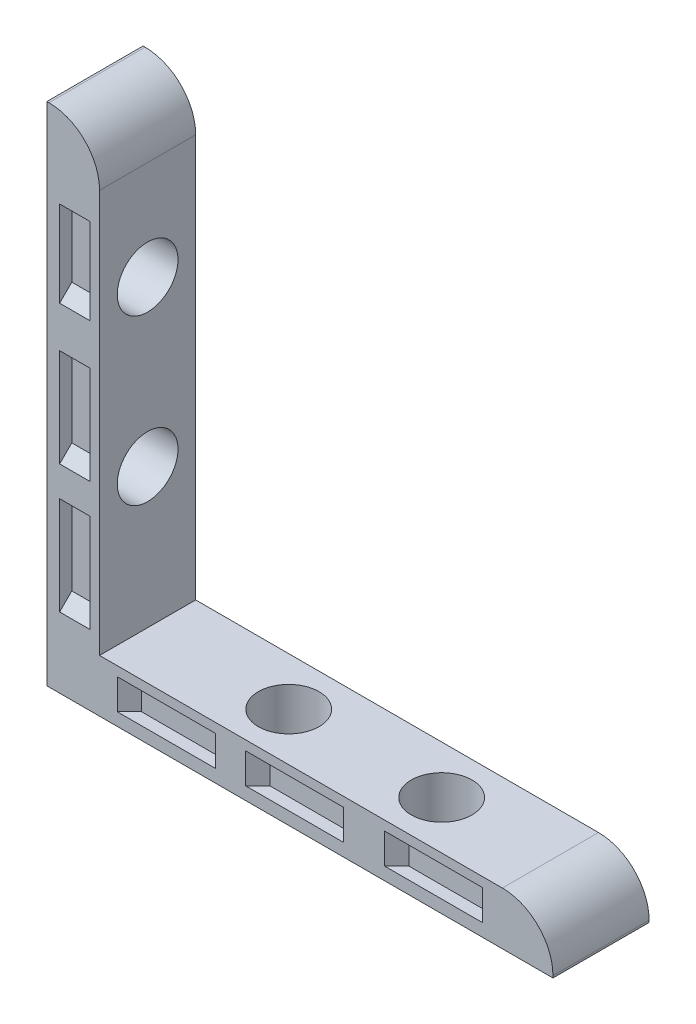
from build123d import *

# Parameters (mm, degrees)
EXTRUDE_1_DEPTH      = 9.5
SKETCH_2_R           = 3
CUT_EXTRUDE_1_DEPTH  = 66.909407523
SKETCH_4_R           = 3
CUT_EXTRUDE_2_DEPTH  = 53.175568995
FILLET_1_R           = 5
SKETCH_5_W           = 3
SKETCH_5_H           = 7.292258694
SKETCH_5_H_2         = 7.292258695
SKETCH_5_W_2         = 7.292258695
SKETCH_5_H_3         = 3
SKETCH_5_W_3         = 7.292258694
CUT_EXTRUDE_3_DEPTH  = 1.2
CHAMFER_1_SIZE       = 1.2
CHAMFER_2_SIZE       = 1.2
MIRROR_START         = -23.741274046
MIRROR_1_OUTLINE_W   = 7.292258694
MIRROR_1_OUTLINE_H   = 1.2
MIRROR_1_OUTLINE_W_2 = 7.292258695
MIRROR_1_DEPTH       = 3
MIRROR_START_2       = -16.84868645
MIRROR_1_2_OUTLINE_W = 3
MIRROR_1_2_OUTLINE_H = 1.2
MIRROR_1_2_DEPTH     = 7.292258695
MIRROR_START_3       = -4.181235969
MIRROR_1_3_OUTLINE_W = 3
MIRROR_1_3_OUTLINE_H = 1.2
MIRROR_1_3_DEPTH     = 7.292258694
MIRROR_START_4       = 9.571089537
MIRROR_1_4_OUTLINE_W = 3
MIRROR_1_4_OUTLINE_H = 1.2
MIRROR_1_4_DEPTH     = 7.292258694


# Read off the part's stored shape, not the designer's step: 镜向1
with BuildPart() as part:
    # 草图1 → 凸台-拉伸1 (new body)
    with BuildSketch(Plane.XY):
        Polygon((-19.8, 2.6), (-19.8, 47.4), (-25, 47.4), (-25, -2.6), (25, -2.6), (25, 2.6), align=None)
    extrude(amount=EXTRUDE_1_DEPTH)

    # 草图2 → 切除-拉伸1 (cut, through all)
    with BuildSketch(Plane(origin=(-19.8, 0, 0), x_dir=(0, 0, -1), z_dir=(1, 0, 0))):
        with Locations((-4.75, 32.604835918)):
            Circle(SKETCH_2_R)
        with Locations((-4.75, 16.388429447)):
            Circle(SKETCH_2_R)
    extrude(amount=-CUT_EXTRUDE_1_DEPTH, mode=Mode.SUBTRACT)

    # 草图4 → 切除-拉伸2 (cut, through all)
    with BuildSketch(Plane(origin=(0, 2.6, 0), x_dir=(1, 0, 0), z_dir=(0, 1, 0))):
        with Locations(Location((9.252806551, -4.75, 0), (0, 0, 270))):
            Circle(SKETCH_4_R)
        with Locations(Location((-5.859043595, -4.75, 0), (0, 0, 270))):
            Circle(SKETCH_4_R)
    extrude(amount=-CUT_EXTRUDE_2_DEPTH, mode=Mode.SUBTRACT)

    # 圆角1
    fillet_1_edges = [part.edges().sort_by_distance(p)[0] for p in [
        (-19.8, 47.4, 4.75),
        (25, 2.6, 4.75),
    ]]
    fillet(fillet_1_edges, radius=FILLET_1_R)

    # 草图5 → 切除-拉伸3 (cut)
    with BuildSketch(Plane.XY.offset(9.5)):
        with Locations((-22.241274046, 21.864893378)):
            Rectangle(SKETCH_5_W, SKETCH_5_H)
        with Locations((-22.241274046, 35.617218884)):
            Rectangle(SKETCH_5_W, SKETCH_5_H)
        with Locations((-22.241274046, 9.197442898)):
            Rectangle(SKETCH_5_W, SKETCH_5_H_2)
        with Locations((-13.202557103, 0.158725954)):
            Rectangle(SKETCH_5_W_2, SKETCH_5_H_3)
        with Locations((-0.535106622, 0.158725954)):
            Rectangle(SKETCH_5_W_3, SKETCH_5_H_3)
        with Locations((13.217218884, 0.158725954)):
            Rectangle(SKETCH_5_W_3, SKETCH_5_H_3)
    extrude(amount=-CUT_EXTRUDE_3_DEPTH, mode=Mode.SUBTRACT)

    # 倒角1
    chamfer_1_edges = [part.edges().sort_by_distance(p)[0] for p in [
        (-22.241274046, 5.55131355, 9.5),
        (-22.241274046, 12.843572245, 9.5),
        (-22.241274046, 18.218764031, 9.5),
        (-22.241274046, 25.511022725, 9.5),
        (-22.241274046, 39.263348231, 8.3),
        (-22.241274046, 31.971089537, 9.5),
    ]]
    chamfer(chamfer_1_edges, length=CHAMFER_1_SIZE - 0.0001)  # a hair under: the kernel refuses the full size

    # 倒角2
    chamfer_2_edges = [part.edges().sort_by_distance(p)[0] for p in [
        (16.863348231, 0.158725954, 9.5),
        (9.571089537, 0.158725954, 9.5),
        (3.111022725, 0.158725954, 9.5),
        (-4.181235969, 0.158725954, 9.5),
        (-9.556427755, 0.158725954, 9.5),
        (-16.84868645, 0.158725954, 9.5),
    ]]
    chamfer(chamfer_2_edges, length=CHAMFER_2_SIZE - 0.0001)  # a hair under: the kernel refuses the full size

    # 镜向1 outline → 镜向1 (cut)
    with BuildSketch(Plane.YZ.offset(MIRROR_START)):
        Polygon((31.971089537, 1.2), (31.971089537, 0), (39.263348231, 0), (38.063348231, 1.2), align=None)
        with Locations((21.864893378, 0.6)):
            Rectangle(MIRROR_1_OUTLINE_W, MIRROR_1_OUTLINE_H)
        with Locations((9.197442898, 0.6)):
            Rectangle(MIRROR_1_OUTLINE_W_2, MIRROR_1_OUTLINE_H)
    extrude(amount=MIRROR_1_DEPTH, mode=Mode.SUBTRACT)

    # Mirror 1 2 outline → Mirror 1 2 (cut)
    with BuildSketch(Plane.YZ.offset(MIRROR_START_2)):
        with Locations((0.158725954, 0.6)):
            Rectangle(MIRROR_1_2_OUTLINE_W, MIRROR_1_2_OUTLINE_H)
    extrude(amount=MIRROR_1_2_DEPTH, mode=Mode.SUBTRACT)

    # Mirror 1 3 outline → Mirror 1 3 (cut)
    with BuildSketch(Plane.YZ.offset(MIRROR_START_3)):
        with Locations((0.158725954, 0.6)):
            Rectangle(MIRROR_1_3_OUTLINE_W, MIRROR_1_3_OUTLINE_H)
    extrude(amount=MIRROR_1_3_DEPTH, mode=Mode.SUBTRACT)

    # Mirror 1 4 outline → Mirror 1 4 (cut)
    with BuildSketch(Plane.YZ.offset(MIRROR_START_4)):
        with Locations((0.158725954, 0.6)):
            Rectangle(MIRROR_1_4_OUTLINE_W, MIRROR_1_4_OUTLINE_H)
    extrude(amount=MIRROR_1_4_DEPTH, mode=Mode.SUBTRACT)


solid = part.part
